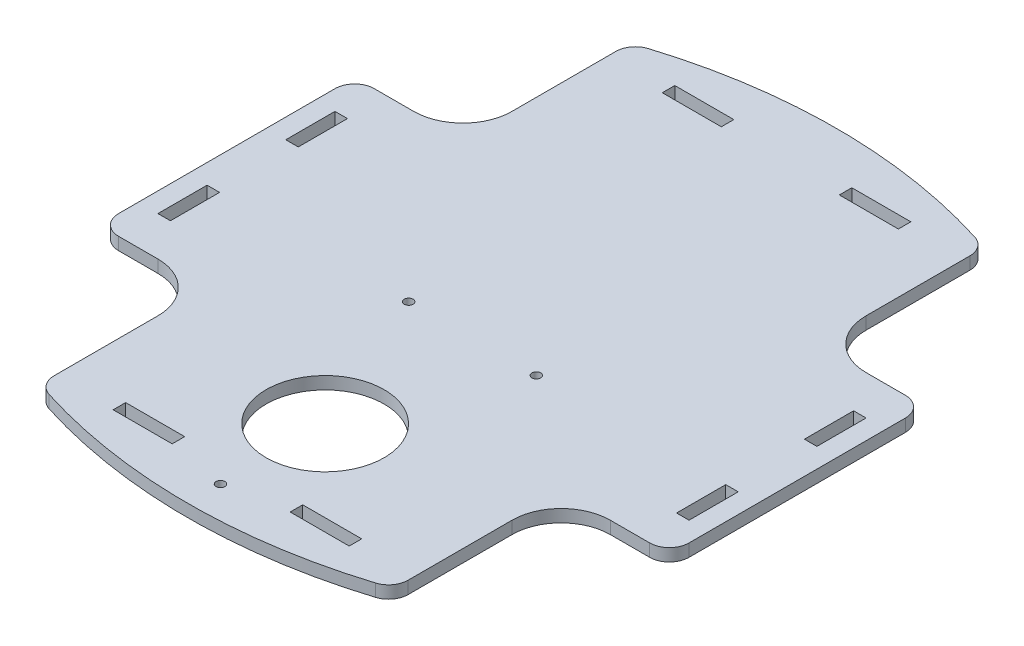
from build123d import *

# Parameters (mm, degrees)
BOSS_EXTRU_1_DEPTH      = 6.35
CONG_1_R                = 25
CONG_2_R                = 10
ENL_V_MAT_EXTRU_1_REACH = 221.751
ESQUISSE2_R             = 30
ENL_V_MAT_EXTRU_2_REACH = 221.751
ESQUISSE3_R             = 2.25
ENL_V_MAT_EXTRU_3_REACH = 221.751
ESQUISSE5_W             = 30
ESQUISSE5_H             = 6.35
ESQUISSE5_W_2           = 6.35
ESQUISSE5_H_2           = 25


with BuildPart() as part:
    # Esquisse1 → Boss.-Extru.1 (new body)
    with BuildSketch(Plane(origin=(0, 0, 0), x_dir=(1, 0, 0), z_dir=(0, 1, 0))):
        with BuildLine():
            Line((-90, -65), (-90, -150))
            ThreePointArc((-90, -150), (0, -165), (90, -150))
            Line((90, -150), (90, -65))
            Line((90, -65), (145, -65))
            Line((145, -65), (145, 65))
            Line((145, 65), (90, 65))
            Line((90, 65), (90, 150))
            ThreePointArc((90, 150), (0, 165), (-90, 150))
            Line((-90, 150), (-90, 65))
            Line((-90, 65), (-145, 65))
            Line((-145, 65), (-145, -65))
            Line((-145, -65), (-90, -65))
        make_face()
    extrude(amount=BOSS_EXTRU_1_DEPTH)

    # Congé1
    cong_1_edges = [part.edges().sort_by_distance(p)[0] for p in [
        (90, 3.175, -65),
        (-90, 3.175, -65),
        (-90, 3.175, 65),
        (90, 3.175, 65),
    ]]
    fillet(cong_1_edges, radius=CONG_1_R)

    # Congé2
    cong_2_edges = [part.edges().sort_by_distance(p)[0] for p in [
        (-90, 3.175, -150),
        (-145, 3.175, -65),
        (-145, 3.175, 65),
        (-90, 3.175, 150),
        (90, 3.175, -150),
        (145, 3.175, -65),
        (145, 3.175, 65),
        (90, 3.175, 150),
    ]]
    fillet(cong_2_edges, radius=CONG_2_R)

    # Esquisse2 → Enlèv. mat.-Extru.1 (cut, up to next)
    with BuildSketch(Plane(origin=(0, 6.35, 0), x_dir=(1, 0, 0), z_dir=(0, 1, 0)), mode=Mode.PRIVATE) as enl_v_mat_extru_1_sk1:
        with Locations((0, -95)):
            Circle(ESQUISSE2_R)
    enl_v_mat_extru_1_tool1 = extrude(enl_v_mat_extru_1_sk1.sketch, amount=-ENL_V_MAT_EXTRU_1_REACH, mode=Mode.PRIVATE) & part.part
    add(enl_v_mat_extru_1_tool1.solids().sort_by_distance((0, 6.35, 95))[0], mode=Mode.SUBTRACT)

    # Esquisse3 → Enlèv. mat.-Extru.2 (cut, up to next)
    with BuildSketch(Plane(origin=(0, 6.35, 0), x_dir=(1, 0, 0), z_dir=(0, 1, 0)), mode=Mode.PRIVATE) as enl_v_mat_extru_2_sk1:
        with Locations((-32.430740144, -20.063884254)):
            Circle(ESQUISSE3_R)
    enl_v_mat_extru_2_tool1 = extrude(enl_v_mat_extru_2_sk1.sketch, amount=-ENL_V_MAT_EXTRU_2_REACH, mode=Mode.PRIVATE) & part.part
    # Esquisse3 → Enlèv. mat.-Extru.2 (cut, up to next)
    with BuildSketch(Plane(origin=(0, 6.35, 0), x_dir=(1, 0, 0), z_dir=(0, 1, 0)), mode=Mode.PRIVATE) as enl_v_mat_extru_2_sk2:
        with Locations((32.430740144, -20.063884254)):
            Circle(ESQUISSE3_R)
    enl_v_mat_extru_2_tool2 = extrude(enl_v_mat_extru_2_sk2.sketch, amount=-ENL_V_MAT_EXTRU_2_REACH, mode=Mode.PRIVATE) & part.part
    # Esquisse3 → Enlèv. mat.-Extru.2 (cut, up to next)
    with BuildSketch(Plane(origin=(0, 6.35, 0), x_dir=(1, 0, 0), z_dir=(0, 1, 0)), mode=Mode.PRIVATE) as enl_v_mat_extru_2_sk3:
        with Locations((0, -148.187083331)):
            Circle(ESQUISSE3_R)
    enl_v_mat_extru_2_tool3 = extrude(enl_v_mat_extru_2_sk3.sketch, amount=-ENL_V_MAT_EXTRU_2_REACH, mode=Mode.PRIVATE) & part.part
    add(enl_v_mat_extru_2_tool1.solids().sort_by_distance((-32.43074, 6.35, 20.063884))[0], mode=Mode.SUBTRACT)
    add(enl_v_mat_extru_2_tool2.solids().sort_by_distance((32.43074, 6.35, 20.063884))[0], mode=Mode.SUBTRACT)
    add(enl_v_mat_extru_2_tool3.solids().sort_by_distance((0, 6.35, 148.187083))[0], mode=Mode.SUBTRACT)

    # Esquisse5 → Enlèv. mat.-Extru.3 (cut, up to next)
    with BuildSketch(Plane(origin=(0, 6.35, 0), x_dir=(1, 0, 0), z_dir=(0, 1, 0)), mode=Mode.PRIVATE) as enl_v_mat_extru_3_sk1:
        with Locations((-45, 139.582223208)):
            Rectangle(ESQUISSE5_W, ESQUISSE5_H)
    enl_v_mat_extru_3_tool1 = extrude(enl_v_mat_extru_3_sk1.sketch, amount=-ENL_V_MAT_EXTRU_3_REACH, mode=Mode.PRIVATE) & part.part
    # Esquisse5 → Enlèv. mat.-Extru.3 (cut, up to next)
    with BuildSketch(Plane(origin=(0, 6.35, 0), x_dir=(1, 0, 0), z_dir=(0, 1, 0)), mode=Mode.PRIVATE) as enl_v_mat_extru_3_sk2:
        with Locations((45, 139.582223208)):
            Rectangle(ESQUISSE5_W, ESQUISSE5_H)
    enl_v_mat_extru_3_tool2 = extrude(enl_v_mat_extru_3_sk2.sketch, amount=-ENL_V_MAT_EXTRU_3_REACH, mode=Mode.PRIVATE) & part.part
    # Esquisse5 → Enlèv. mat.-Extru.3 (cut, up to next)
    with BuildSketch(Plane(origin=(0, 6.35, 0), x_dir=(1, 0, 0), z_dir=(0, 1, 0)), mode=Mode.PRIVATE) as enl_v_mat_extru_3_sk3:
        with Locations((-45, -139.582223208)):
            Rectangle(ESQUISSE5_W, ESQUISSE5_H)
    enl_v_mat_extru_3_tool3 = extrude(enl_v_mat_extru_3_sk3.sketch, amount=-ENL_V_MAT_EXTRU_3_REACH, mode=Mode.PRIVATE) & part.part
    # Esquisse5 → Enlèv. mat.-Extru.3 (cut, up to next)
    with BuildSketch(Plane(origin=(0, 6.35, 0), x_dir=(1, 0, 0), z_dir=(0, 1, 0)), mode=Mode.PRIVATE) as enl_v_mat_extru_3_sk4:
        with Locations((45, -139.582223208)):
            Rectangle(ESQUISSE5_W, ESQUISSE5_H)
    enl_v_mat_extru_3_tool4 = extrude(enl_v_mat_extru_3_sk4.sketch, amount=-ENL_V_MAT_EXTRU_3_REACH, mode=Mode.PRIVATE) & part.part
    # Esquisse5 → Enlèv. mat.-Extru.3 (cut, up to next)
    with BuildSketch(Plane(origin=(0, 6.35, 0), x_dir=(1, 0, 0), z_dir=(0, 1, 0)), mode=Mode.PRIVATE) as enl_v_mat_extru_3_sk5:
        with Locations((131.825, -32.5)):
            Rectangle(ESQUISSE5_W_2, ESQUISSE5_H_2)
    enl_v_mat_extru_3_tool5 = extrude(enl_v_mat_extru_3_sk5.sketch, amount=-ENL_V_MAT_EXTRU_3_REACH, mode=Mode.PRIVATE) & part.part
    # Esquisse5 → Enlèv. mat.-Extru.3 (cut, up to next)
    with BuildSketch(Plane(origin=(0, 6.35, 0), x_dir=(1, 0, 0), z_dir=(0, 1, 0)), mode=Mode.PRIVATE) as enl_v_mat_extru_3_sk6:
        with Locations((131.825, 32.5)):
            Rectangle(ESQUISSE5_W_2, ESQUISSE5_H_2)
    enl_v_mat_extru_3_tool6 = extrude(enl_v_mat_extru_3_sk6.sketch, amount=-ENL_V_MAT_EXTRU_3_REACH, mode=Mode.PRIVATE) & part.part
    # Esquisse5 → Enlèv. mat.-Extru.3 (cut, up to next)
    with BuildSketch(Plane(origin=(0, 6.35, 0), x_dir=(1, 0, 0), z_dir=(0, 1, 0)), mode=Mode.PRIVATE) as enl_v_mat_extru_3_sk7:
        with Locations((-131.825, 32.5)):
            Rectangle(ESQUISSE5_W_2, ESQUISSE5_H_2)
    enl_v_mat_extru_3_tool7 = extrude(enl_v_mat_extru_3_sk7.sketch, amount=-ENL_V_MAT_EXTRU_3_REACH, mode=Mode.PRIVATE) & part.part
    # Esquisse5 → Enlèv. mat.-Extru.3 (cut, up to next)
    with BuildSketch(Plane(origin=(0, 6.35, 0), x_dir=(1, 0, 0), z_dir=(0, 1, 0)), mode=Mode.PRIVATE) as enl_v_mat_extru_3_sk8:
        with Locations((-131.825, -32.5)):
            Rectangle(ESQUISSE5_W_2, ESQUISSE5_H_2)
    enl_v_mat_extru_3_tool8 = extrude(enl_v_mat_extru_3_sk8.sketch, amount=-ENL_V_MAT_EXTRU_3_REACH, mode=Mode.PRIVATE) & part.part
    add(enl_v_mat_extru_3_tool1.solids().sort_by_distance((-45, 6.35, -139.582223))[0], mode=Mode.SUBTRACT)
    add(enl_v_mat_extru_3_tool2.solids().sort_by_distance((45, 6.35, -139.582223))[0], mode=Mode.SUBTRACT)
    add(enl_v_mat_extru_3_tool3.solids().sort_by_distance((-45, 6.35, 139.582223))[0], mode=Mode.SUBTRACT)
    add(enl_v_mat_extru_3_tool4.solids().sort_by_distance((45, 6.35, 139.582223))[0], mode=Mode.SUBTRACT)
    add(enl_v_mat_extru_3_tool5.solids().sort_by_distance((131.825, 6.35, 32.5))[0], mode=Mode.SUBTRACT)
    add(enl_v_mat_extru_3_tool6.solids().sort_by_distance((131.825, 6.35, -32.5))[0], mode=Mode.SUBTRACT)
    add(enl_v_mat_extru_3_tool7.solids().sort_by_distance((-131.825, 6.35, -32.5))[0], mode=Mode.SUBTRACT)
    add(enl_v_mat_extru_3_tool8.solids().sort_by_distance((-131.825, 6.35, 32.5))[0], mode=Mode.SUBTRACT)


solid = part.part
